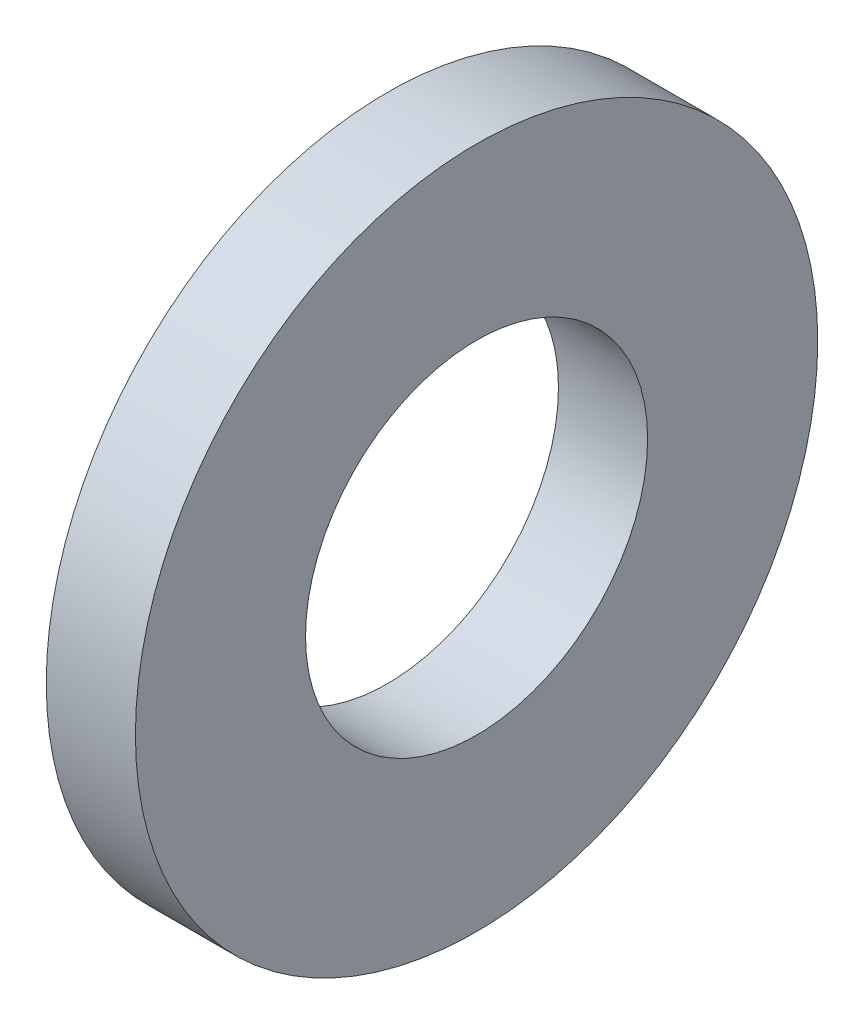
from build123d import *

# Parameters (mm, degrees)
SKETCH1_W = 1.2446
SKETCH1_H = 2.3749


with BuildPart() as part:
    # Sketch1 → Revolve1 (revolve)
    with BuildSketch(Plane(origin=(0, 0, 0), x_dir=(-1, 0, 0), z_dir=(0, 0, -1))):
        with Locations((0.6223, 3.57505)):
            Rectangle(SKETCH1_W, SKETCH1_H)
    revolve(axis=Axis((0, 0, 0), (-1, 0, 0)))


solid = part.part
